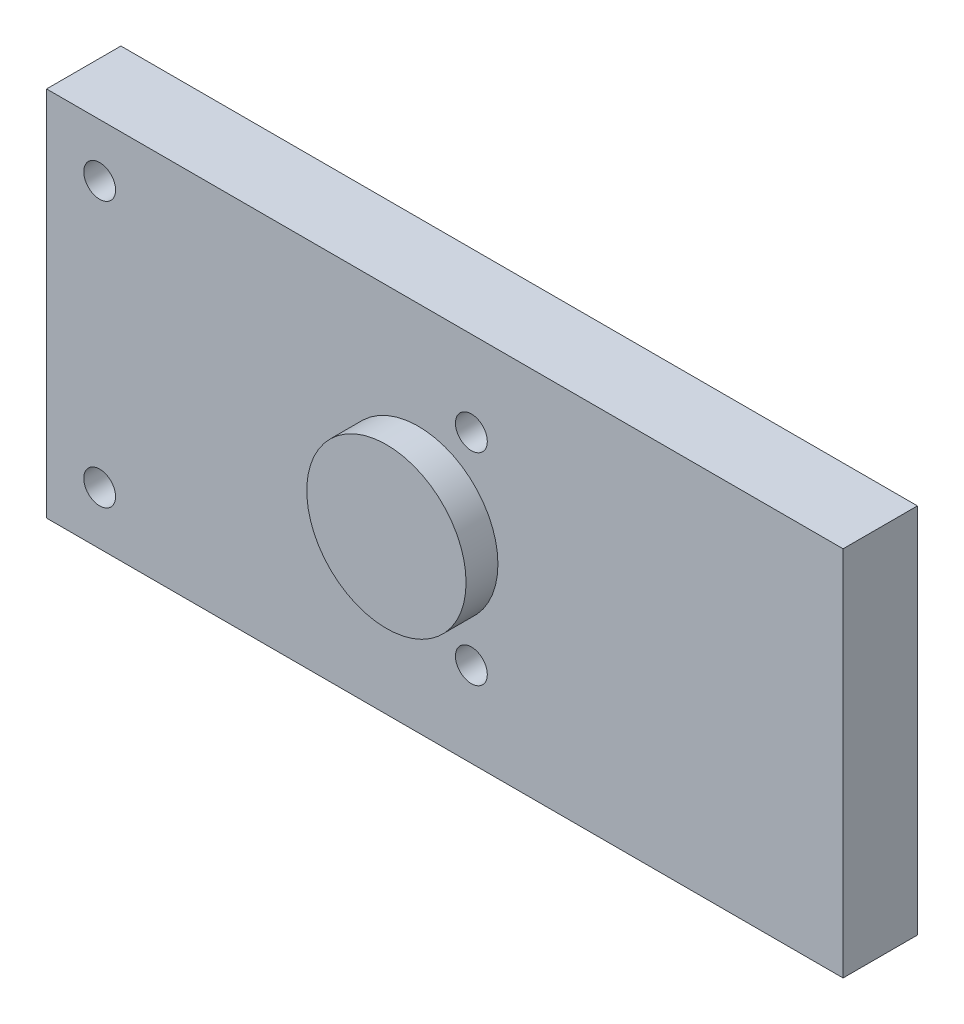
from build123d import *

# Parameters (mm, degrees)
SKETCH1_W               = 75
SKETCH1_H               = 35
SKETCH1_R               = 1.5
BOSS_EXTRUDE1_DEPTH     = 7
SKETCH5_R               = 7.5
BOSS_EXTRUDE5_DEPTH     = 3
CUT_EXTRUDE1_DEPTH      = 3
CUT_EXTRUDE1_DEPTH_BACK = 3
SKETCH1_3_R             = 4


with BuildPart() as part:
    # Sketch1 → Boss-Extrude1 (new body)
    with BuildSketch(Plane.XY):
        with Locations((-55, 0)):
            Rectangle(SKETCH1_W, SKETCH1_H)
        with Locations((-87.5, -12.5)):
            Circle(SKETCH1_R, mode=Mode.SUBTRACT)
        with Locations((-52.5, -9.5)):
            Circle(SKETCH1_R, mode=Mode.SUBTRACT)
        with Locations((-87.5, 12.5)):
            Circle(SKETCH1_R, mode=Mode.SUBTRACT)
        with Locations((-52.5, 9.5)):
            Circle(SKETCH1_R, mode=Mode.SUBTRACT)
    extrude(amount=BOSS_EXTRUDE1_DEPTH)

    # Sketch5 → Boss-Extrude5 (add)
    with BuildSketch(Plane.XY.offset(7)):
        with Locations((-57.5, 0)):
            Circle(SKETCH5_R)
    extrude(amount=BOSS_EXTRUDE5_DEPTH)

    # Sketch1<3> → Cut-Extrude1 (cut, two sides: drawn at the far end of the back side and taken through both)
    with BuildSketch(Plane.XY.offset(-CUT_EXTRUDE1_DEPTH_BACK)):
        with Locations((-57.5, 0)):
            Circle(SKETCH1_3_R)
    extrude(amount=CUT_EXTRUDE1_DEPTH + CUT_EXTRUDE1_DEPTH_BACK, mode=Mode.SUBTRACT)


solid = part.part
